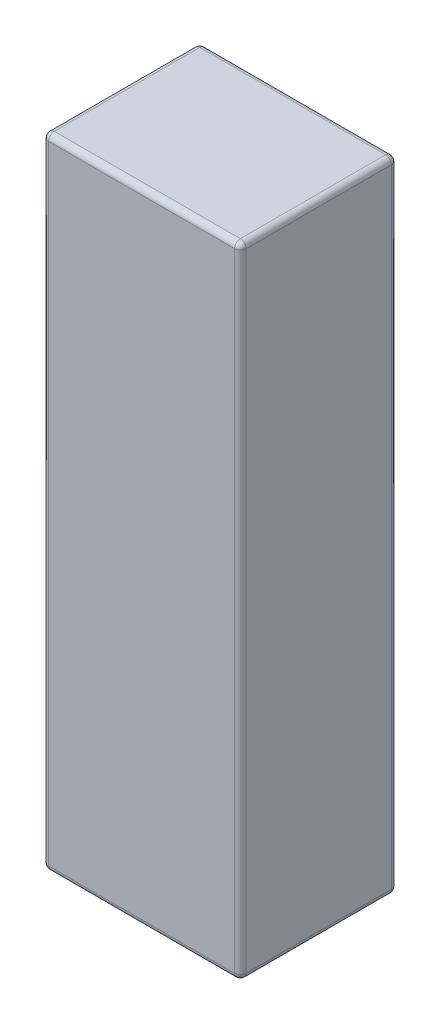
from build123d import *

# Parameters (mm, degrees)
SKIZZE1_W                       = 17
SKIZZE1_H                       = 13.5
AUFSATZ_LINEAR_AUSTRAGEN1_DEPTH = 55
VERRUNDUNG1_R                   = 0.5


with BuildPart() as part:
    # Skizze1 → Aufsatz-Linear austragen1 (new body)
    with BuildSketch(Plane(origin=(0, 0, 0), x_dir=(1, 0, 0), z_dir=(0, 1, 0))):
        Rectangle(SKIZZE1_W, SKIZZE1_H)
    extrude(amount=AUFSATZ_LINEAR_AUSTRAGEN1_DEPTH)

    # Verrundung1
    verrundung1_edges = [part.edges().sort_by_distance(p)[0] for p in [
        (8.5, 55, 0),
        (0, 55, 6.75),
        (8.5, 27.5, 6.75),
        (0, 0, 6.75),
        (8.5, 0, 0),
        (-8.5, 55, 0),
        (-8.5, 27.5, 6.75),
        (-8.5, 0, 0),
        (8.5, 27.5, -6.75),
        (0, 55, -6.75),
        (-8.5, 27.5, -6.75),
        (0, 0, -6.75),
    ]]
    fillet(verrundung1_edges, radius=VERRUNDUNG1_R)


solid = part.part
